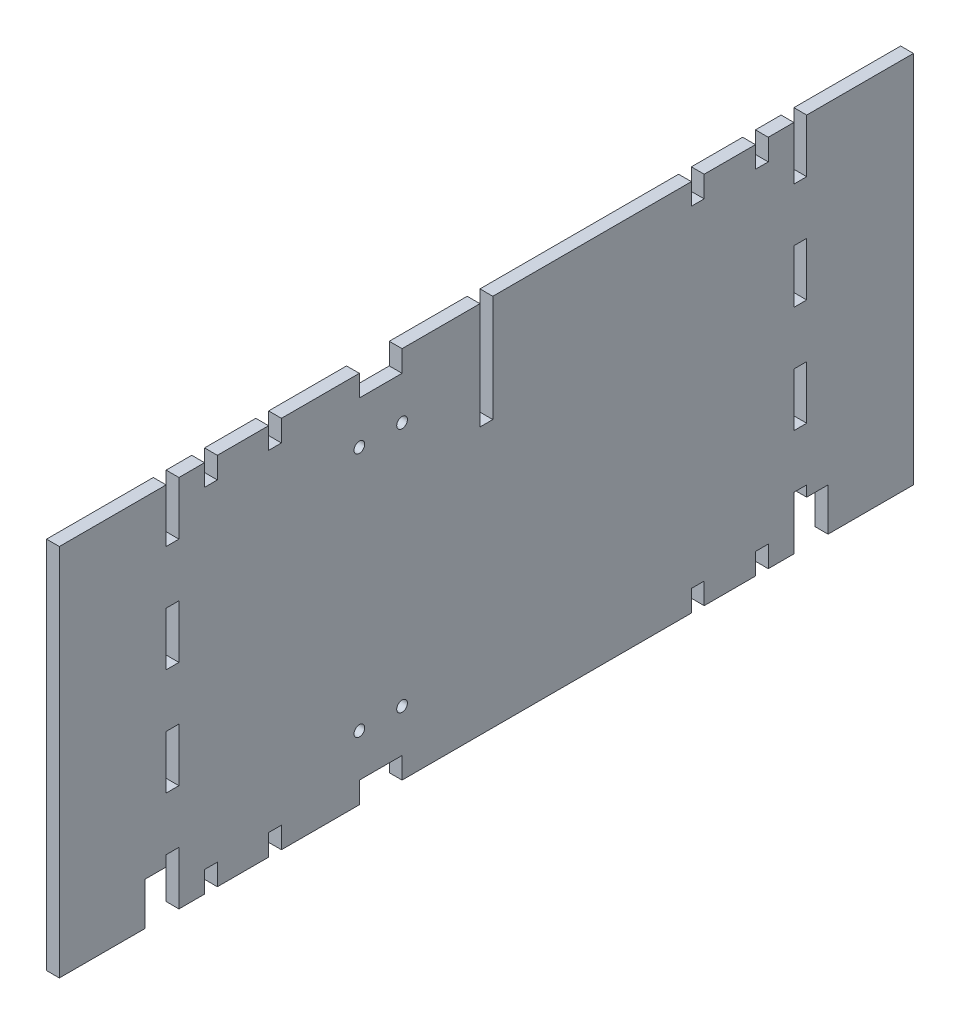
from build123d import *

# Parameters (mm, degrees)
SKETCH1_W            = 400
SKETCH1_H            = 175
BOSS_EXTRUDE1_DEPTH  = 6
SKETCH3_W            = 6
SKETCH3_H            = 25
CUT_EXTRUDE1_DEPTH   = 437.647455048
LPATTERN1_COUNT      = 2
LPATTERN1_PITCH      = 294
LPATTERN1_COUNT_DIR2 = 4
LPATTERN1_PITCH_DIR2 = 50
SKETCH4_W            = 6
SKETCH4_H            = 10
CUT_EXTRUDE2_DEPTH   = 437.647455048
LPATTERN2_COUNT      = 2
LPATTERN2_PITCH      = 258
LPATTERN2_COUNT_DIR2 = 2
LPATTERN2_PITCH_DIR2 = 165
SKETCH5_W            = 6
SKETCH5_H            = 10
CUT_EXTRUDE3_DEPTH   = 437.647455048
LPATTERN3_COUNT      = 2
LPATTERN3_PITCH      = 165
LPATTERN3_COUNT_DIR2 = 2
LPATTERN3_PITCH_DIR2 = 198
SKETCH6_W            = 6
SKETCH6_H            = 50
CUT_EXTRUDE4_DEPTH   = 10
SKETCH7_W            = 20
SKETCH7_H            = 10
CUT_EXTRUDE5_DEPTH   = 10
LPATTERN4_COUNT      = 2
LPATTERN4_PITCH      = 165
SKETCH8_R            = 2.5
CUT_EXTRUDE6_DEPTH   = 10
SKETCH9_W            = 10
SKETCH9_H            = 20
CUT_EXTRUDE7_DEPTH   = 10
LPATTERN5_COUNT      = 2
LPATTERN5_PITCH      = 310


with BuildPart() as part:
    # Sketch1 → Boss-Extrude1 (new body)
    with BuildSketch(Plane(origin=(0, 0, 0), x_dir=(0, 0, -1), z_dir=(1, 0, 0))):
        with Locations((-200, 87.5)):
            Rectangle(SKETCH1_W, SKETCH1_H)
    extrude(amount=BOSS_EXTRUDE1_DEPTH)

    # Sketch3 → Cut-Extrude1 (cut, through all)
    with BuildSketch(Plane(origin=(6, 0, 0), x_dir=(0, 0, -1), z_dir=(1, 0, 0))):
        with Locations((-347, 162.5)):
            Rectangle(SKETCH3_W, SKETCH3_H)
    cut_extrude1 = extrude(amount=-CUT_EXTRUDE1_DEPTH, mode=Mode.SUBTRACT)

    # LPattern1: Cut-Extrude1 2 × 4
    with Locations(*[(0, -j * LPATTERN1_PITCH_DIR2, -i * LPATTERN1_PITCH) for i in range(LPATTERN1_COUNT) for j in range(LPATTERN1_COUNT_DIR2) if (i, j) != (0, 0)]):
        add(cut_extrude1, mode=Mode.SUBTRACT)

    # Sketch4 → Cut-Extrude2 (cut, through all)
    with BuildSketch(Plane(origin=(6, 0, 0), x_dir=(0, 0, -1), z_dir=(1, 0, 0))):
        with Locations((-329, 170)):
            Rectangle(SKETCH4_W, SKETCH4_H)
    cut_extrude2 = extrude(amount=-CUT_EXTRUDE2_DEPTH, mode=Mode.SUBTRACT)

    # LPattern2: Cut-Extrude2 2 × 2
    with Locations(*[(0, -j * LPATTERN2_PITCH_DIR2, -i * LPATTERN2_PITCH) for i in range(LPATTERN2_COUNT) for j in range(LPATTERN2_COUNT_DIR2) if (i, j) != (0, 0)]):
        add(cut_extrude2, mode=Mode.SUBTRACT)

    # Sketch5 → Cut-Extrude3 (cut, through all)
    with BuildSketch(Plane(origin=(6, 0, 0), x_dir=(0, 0, -1), z_dir=(1, 0, 0))):
        with Locations((-299, 170)):
            Rectangle(SKETCH5_W, SKETCH5_H)
    cut_extrude3 = extrude(amount=-CUT_EXTRUDE3_DEPTH, mode=Mode.SUBTRACT)

    # LPattern3: Cut-Extrude3 2 × 2
    with Locations(*[(0, -i * LPATTERN3_PITCH, -j * LPATTERN3_PITCH_DIR2) for i in range(LPATTERN3_COUNT) for j in range(LPATTERN3_COUNT_DIR2) if (i, j) != (0, 0)]):
        add(cut_extrude3, mode=Mode.SUBTRACT)

    # Sketch6 → Cut-Extrude4 (cut)
    with BuildSketch(Plane(origin=(6, 0, 0), x_dir=(0, 0, -1), z_dir=(1, 0, 0))):
        with Locations((-200, 150)):
            Rectangle(SKETCH6_W, SKETCH6_H)
    extrude(amount=-CUT_EXTRUDE4_DEPTH, mode=Mode.SUBTRACT)

    # Sketch7 → Cut-Extrude5 (cut)
    with BuildSketch(Plane(origin=(6, 0, 0), x_dir=(0, 0, -1), z_dir=(1, 0, 0))):
        with Locations((-249.5, 170)):
            Rectangle(SKETCH7_W, SKETCH7_H)
    cut_extrude5 = extrude(amount=-CUT_EXTRUDE5_DEPTH, mode=Mode.SUBTRACT)

    # LPattern4: Cut-Extrude5 ×2
    with Locations(*[(0, -i * LPATTERN4_PITCH, 0) for i in range(1, LPATTERN4_COUNT)]):
        add(cut_extrude5, mode=Mode.SUBTRACT)

    # Sketch8 → Cut-Extrude6 (cut)
    with BuildSketch(Plane(origin=(6, 0, 0), x_dir=(0, 0, -1), z_dir=(1, 0, 0))):
        with Locations((-259.5, 145)):
            Circle(SKETCH8_R)
        with Locations((-239.5, 145)):
            Circle(SKETCH8_R)
        with Locations((-259.5, 30)):
            Circle(SKETCH8_R)
        with Locations((-239.5, 30)):
            Circle(SKETCH8_R)
    extrude(amount=-CUT_EXTRUDE6_DEPTH, mode=Mode.SUBTRACT)

    # Sketch9 → Cut-Extrude7 (cut)
    with BuildSketch(Plane(origin=(6, 0, 0), x_dir=(0, 0, -1), z_dir=(1, 0, 0))):
        with Locations((-355, 10)):
            Rectangle(SKETCH9_W, SKETCH9_H)
    cut_extrude7 = extrude(amount=-CUT_EXTRUDE7_DEPTH, mode=Mode.SUBTRACT)

    # LPattern5: Cut-Extrude7 ×2
    with Locations(*[(0, 0, -i * LPATTERN5_PITCH) for i in range(1, LPATTERN5_COUNT)]):
        add(cut_extrude7, mode=Mode.SUBTRACT)


solid = part.part
